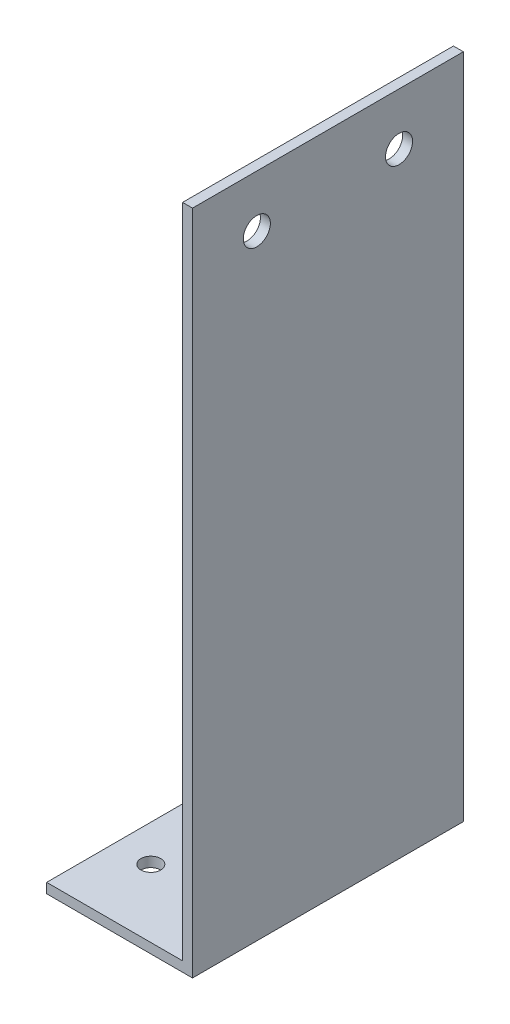
from build123d import *

# Parameters (mm, degrees)
SALIENTE_EXTRUIR1_DEPTH = 65
CROQUIS2_R              = 4.7625
CORTAR_EXTRUIR1_DEPTH   = 130
CROQUIS3_R              = 6.5
CORTAR_EXTRUIR2_DEPTH   = 130


with BuildPart() as part:
    # Croquis1 → Saliente-Extruir1 (new, symmetric)
    with BuildSketch(Plane.XY):
        Polygon((0, 0), (0, 320), (-4.7625, 320), (-4.7625, 4.7625), (-70, 4.7625), (-70, 0), align=None)
    extrude(amount=SALIENTE_EXTRUIR1_DEPTH, both=True)

    # Croquis2 → Cortar-Extruir1 (cut)
    with BuildSketch(Plane(origin=(0, 0, 0), x_dir=(-1, 0, 0), z_dir=(0, -1, 0))):
        with Locations((52.5, -32.5)):
            Circle(CROQUIS2_R)
        with Locations((17.5, -32.5)):
            Circle(CROQUIS2_R)
        with Locations((17.5, 32.5)):
            Circle(CROQUIS2_R)
        with Locations((52.5, 32.5)):
            Circle(CROQUIS2_R)
    extrude(amount=-CORTAR_EXTRUIR1_DEPTH, mode=Mode.SUBTRACT)

    # Croquis3 → Cortar-Extruir2 (cut)
    with BuildSketch(Plane(origin=(0, 0, 0), x_dir=(0, 0, -1), z_dir=(1, 0, 0))):
        with Locations((-34.13125, 295)):
            Circle(CROQUIS3_R)
        with Locations((34.13125, 295)):
            Circle(CROQUIS3_R)
    extrude(amount=-CORTAR_EXTRUIR2_DEPTH, mode=Mode.SUBTRACT)


solid = part.part
